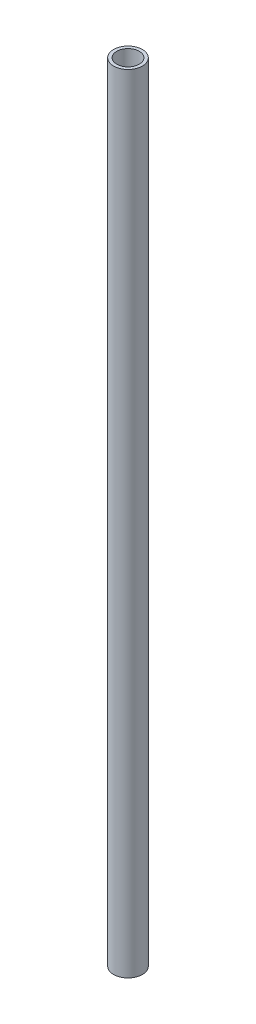
from build123d import *

# Parameters (mm, degrees)
SKETCH1_R           = 16.7005
SKETCH1_R_2         = 13.0683
BOSS_EXTRUDE1_DEPTH = 914.4


with BuildPart() as part:
    # Sketch1 → Boss-Extrude1 (new body)
    with BuildSketch(Plane(origin=(0, 0, 0), x_dir=(1, 0, 0), z_dir=(0, 1, 0))):
        Circle(SKETCH1_R)
        Circle(SKETCH1_R_2, mode=Mode.SUBTRACT)
    extrude(amount=BOSS_EXTRUDE1_DEPTH)


solid = part.part
